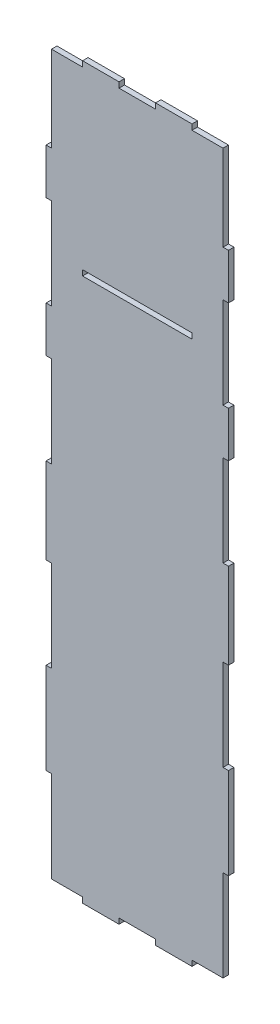
from build123d import *

# Parameters (mm, degrees)
SKETCH1_W           = 100
SKETCH1_H           = 400
BOSS_EXTRUDE1_DEPTH = 3
SKETCH2_W           = 20
SKETCH2_H           = 3
CUT_EXTRUDE1_DEPTH  = 3
SKETCH4_W           = 3
SKETCH4_H           = 47
SKETCH4_H_2         = 50
CUT_EXTRUDE2_DEPTH  = 3
CAVITY1_START       = 97.807385879
CAVITY1_OUTLINE_W   = 60
CAVITY1_OUTLINE_H   = 3
CAVITY1_DEPTH       = 3


# Read off the part's stored shape, not the designer's step: Cavity1
with BuildPart() as part:
    # Sketch1 → Boss-Extrude1 (new body)
    with BuildSketch(Plane.XY):
        Rectangle(SKETCH1_W, SKETCH1_H)
    extrude(amount=BOSS_EXTRUDE1_DEPTH)

    # Sketch2 → Cut-Extrude1 (cut)
    with BuildSketch(Plane.XY.offset(3)):
        with Locations((-40, -198.5)):
            Rectangle(SKETCH2_W, SKETCH2_H)
        with Locations((0, -198.5)):
            Rectangle(SKETCH2_W, SKETCH2_H)
        with Locations((40, -198.5)):
            Rectangle(SKETCH2_W, SKETCH2_H)
        with Locations((40, 198.5)):
            Rectangle(SKETCH2_W, SKETCH2_H)
        with Locations((0, 198.5)):
            Rectangle(SKETCH2_W, SKETCH2_H)
        with Locations((-40, 198.5)):
            Rectangle(SKETCH2_W, SKETCH2_H)
    extrude(amount=-CUT_EXTRUDE1_DEPTH, mode=Mode.SUBTRACT)

    # Sketch4 → Cut-Extrude2 (cut)
    with BuildSketch(Plane(origin=(0, 0, 0), x_dir=(-1, 0, 0), z_dir=(0, 0, -1))):
        with Locations((-48.5, 173.5)):
            Rectangle(SKETCH4_W, SKETCH4_H)
        with Locations((-48.5, 25)):
            Rectangle(SKETCH4_W, SKETCH4_H_2)
        with Locations((-48.5, -72)):
            Rectangle(SKETCH4_W, SKETCH4_H_2)
        with Locations((-48.5, -172)):
            Rectangle(SKETCH4_W, SKETCH4_H_2)
        with Locations((48.5, -172)):
            Rectangle(SKETCH4_W, SKETCH4_H_2)
        with Locations((48.5, -72)):
            Rectangle(SKETCH4_W, SKETCH4_H_2)
        with Locations((48.5, 25)):
            Rectangle(SKETCH4_W, SKETCH4_H_2)
        with Locations((48.5, 173.5)):
            Rectangle(SKETCH4_W, SKETCH4_H)
        with Locations((48.5, 100)):
            Rectangle(SKETCH4_W, SKETCH4_H_2)
        with Locations((-48.5, 100)):
            Rectangle(SKETCH4_W, SKETCH4_H_2)
    extrude(amount=-CUT_EXTRUDE2_DEPTH, mode=Mode.SUBTRACT)

    # Cavity1 outline → Cavity1 (cut)
    with BuildSketch(Plane(origin=(0, 0, 0), x_dir=(1, 0, 0), z_dir=(0, 1, 0)).offset(CAVITY1_START)):
        with Locations((0, -1.5)):
            Rectangle(CAVITY1_OUTLINE_W, CAVITY1_OUTLINE_H)
    extrude(amount=CAVITY1_DEPTH, mode=Mode.SUBTRACT)


solid = part.part
